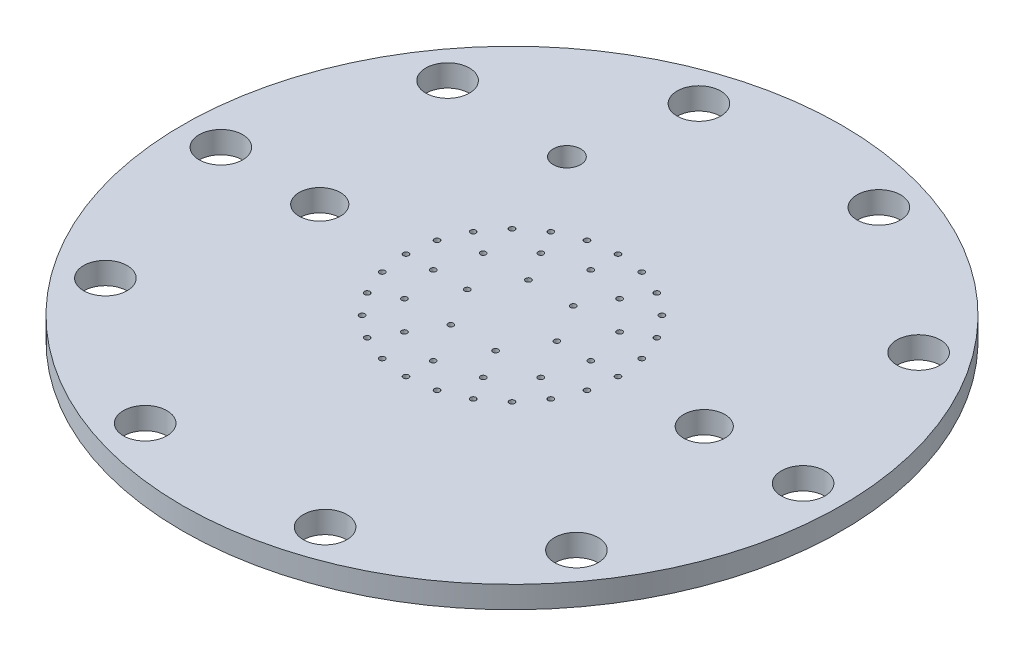
from build123d import *

# Parameters (mm, degrees)
F_3_8_CLEARANCE_HOLE1_D      = 10.0838
CIRPATTERN1_COUNT            = 10
F_3_8_0_375_DIAMETER_HOLE1_D = 9.525
F_1_4_0_25_DIAMETER_HOLE1_D  = 6.35
CUT_EXTRUDE1_DEPTH           = 108.882743755
CUT_EXTRUDE1_DEPTH_BACK      = 108.882743755
SKETCH7_R                    = 0.635


with BuildPart() as part:
    # Sketch1 → Revolve1 (revolve)
    with BuildSketch(Plane.XY):
        Polygon((0, 0), (0, -5.08), (54.8259, -5.08), (54.8259, -2.3876), (58.8899, -2.3876), (58.8899, -5.08), (76.2, -5.08), (76.2, 0), align=None)
    revolve(axis=Axis((0, 0, 0), (0, -1, 0)))

    # 3/8 Clearance Hole1 (through all)
    with Locations(Plane(origin=(67.31, 0, 0), x_dir=(0, 0, 1), z_dir=(0, 1, 0))):
        with Locations((0, 0)):
            f_3_8_clearance_hole1 = Hole(F_3_8_CLEARANCE_HOLE1_D / 2)

    # CirPattern1: 3/8 Clearance Hole1 ×10 about axis
    cirpattern1_axis = Axis((0, -5.334, 0), (0, 1, 0))
    for i in range(1, CIRPATTERN1_COUNT):
        add(f_3_8_clearance_hole1.rotate(cirpattern1_axis, i * 360 / CIRPATTERN1_COUNT), mode=Mode.SUBTRACT)

    # 3/8 (0.375) Diameter Hole1 (through all)
    with Locations(Plane(origin=(44.45, 0, 0), x_dir=(0, 0, 1), z_dir=(0, 1, 0))):
        with Locations((0, 0), (0, -88.9)):
            Hole(F_3_8_0_375_DIAMETER_HOLE1_D / 2)

    # 1/4 (0.25) Diameter Hole1 (through all)
    with Locations(Plane(origin=(-25.4, 0, -38.1), x_dir=(0, 0, 1), z_dir=(0, 1, 0))):
        with Locations((0, 0)):
            Hole(F_1_4_0_25_DIAMETER_HOLE1_D / 2)

    # Sketch7 → Cut-Extrude1 (cut, two sides: drawn at the far end of the back side and taken through both)
    with BuildSketch(Plane(origin=(0, 0, 0), x_dir=(1, 0, 0), z_dir=(0, 1, 0)).offset(-CUT_EXTRUDE1_DEPTH_BACK)):
        with Locations((10.3632, 0)):
            Circle(SKETCH7_R)
        with Locations((18.2118, 0)):
            Circle(SKETCH7_R)
        with Locations((24.511, 0)):
            Circle(SKETCH7_R)
        with Locations((5.1816, -8.974794464)):
            Circle(SKETCH7_R)
        with Locations((-5.1816, -8.974794464)):
            Circle(SKETCH7_R)
        with Locations((-10.3632, 0)):
            Circle(SKETCH7_R)
        with Locations((-5.1816, 8.974794464)):
            Circle(SKETCH7_R)
        with Locations((5.1816, 8.974794464)):
            Circle(SKETCH7_R)
        with Locations((15.771881449, -9.1059)):
            Circle(SKETCH7_R)
        with Locations((9.1059, -15.771881449)):
            Circle(SKETCH7_R)
        with Locations((0, -18.2118)):
            Circle(SKETCH7_R)
        with Locations((-9.1059, -15.771881449)):
            Circle(SKETCH7_R)
        with Locations((-15.771881449, -9.1059)):
            Circle(SKETCH7_R)
        with Locations((-18.2118, 0)):
            Circle(SKETCH7_R)
        with Locations((-15.771881449, 9.1059)):
            Circle(SKETCH7_R)
        with Locations((-9.1059, 15.771881449)):
            Circle(SKETCH7_R)
        with Locations((0, 18.2118)):
            Circle(SKETCH7_R)
        with Locations((9.1059, 15.771881449)):
            Circle(SKETCH7_R)
        with Locations((15.771881449, 9.1059)):
            Circle(SKETCH7_R)
        with Locations((23.675807928, -6.343913615)):
            Circle(SKETCH7_R)
        with Locations((21.227148672, -12.2555)):
            Circle(SKETCH7_R)
        with Locations((17.331894314, -17.331894314)):
            Circle(SKETCH7_R)
        with Locations((12.2555, -21.227148672)):
            Circle(SKETCH7_R)
        with Locations((6.343913615, -23.675807928)):
            Circle(SKETCH7_R)
        with Locations((0, -24.511)):
            Circle(SKETCH7_R)
        with Locations((-6.343913615, -23.675807928)):
            Circle(SKETCH7_R)
        with Locations((-12.2555, -21.227148672)):
            Circle(SKETCH7_R)
        with Locations((-17.331894314, -17.331894314)):
            Circle(SKETCH7_R)
        with Locations((-21.227148672, -12.2555)):
            Circle(SKETCH7_R)
        with Locations((-23.675807928, -6.343913615)):
            Circle(SKETCH7_R)
        with Locations((-24.511, 0)):
            Circle(SKETCH7_R)
        with Locations((-23.675807928, 6.343913615)):
            Circle(SKETCH7_R)
        with Locations((-21.227148672, 12.2555)):
            Circle(SKETCH7_R)
        with Locations((-17.331894314, 17.331894314)):
            Circle(SKETCH7_R)
        with Locations((-12.2555, 21.227148672)):
            Circle(SKETCH7_R)
        with Locations((-6.343913615, 23.675807928)):
            Circle(SKETCH7_R)
        with Locations((0, 24.511)):
            Circle(SKETCH7_R)
        with Locations((6.343913615, 23.675807928)):
            Circle(SKETCH7_R)
        with Locations((12.2555, 21.227148672)):
            Circle(SKETCH7_R)
        with Locations((17.331894314, 17.331894314)):
            Circle(SKETCH7_R)
        with Locations((21.227148672, 12.2555)):
            Circle(SKETCH7_R)
        with Locations((23.675807928, 6.343913615)):
            Circle(SKETCH7_R)
    extrude(amount=CUT_EXTRUDE1_DEPTH + CUT_EXTRUDE1_DEPTH_BACK, mode=Mode.SUBTRACT)


solid = part.part
